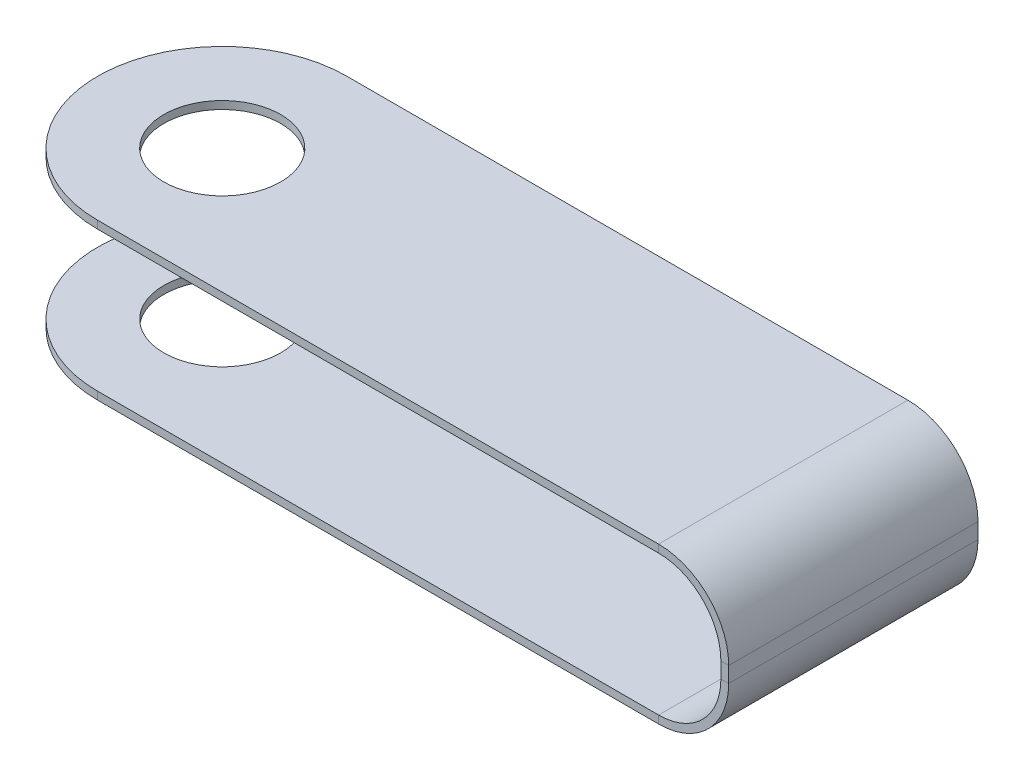
from build123d import *

# Parameters (mm, degrees)
BASE_FLANGE1_DEPTH  = 16
CUT_EXTRUDE1_DEPTH  = 53.04084934
SKETCH7_R           = 3.75
BOSS_EXTRUDE1_DEPTH = 2
CUT_EXTRUDE2_START  = -2
SKETCH8_R           = 3.75
CUT_EXTRUDE2_DEPTH  = 2
BOSS_EXTRUDE2_START = -2
SKETCH9_R           = 3.75
BOSS_EXTRUDE2_DEPTH = 2
CUT_EXTRUDE4_START  = -2
SKETCH10_R          = 3.75
CUT_EXTRUDE4_DEPTH  = 2


# Sheet-metal steps are written as plain solids
with BuildPart() as part:
    # Sketch1 → Base-Flange1 (new body)
    with BuildSketch(Plane.XY):
        with BuildLine():
            Line((0, 0), (44, 0))
            ThreePointArc((44, 0), (46.828427125, 1.171572875), (48, 4))
            Line((48, 4), (48, 5))
            ThreePointArc((48, 5), (46.828427125, 7.828427125), (44, 9))
            Line((44, 9), (0, 9))
            Line((0, 9), (0, 9.5))
            Line((0, 9.5), (44, 9.5))
            ThreePointArc((44, 9.5), (47.181980515, 8.181980515), (48.5, 5))
            Line((48.5, 5), (48.5, 4))
            ThreePointArc((48.5, 4), (47.181980515, 0.818019485), (44, -0.5))
            Line((44, -0.5), (0, -0.5))
            Line((0, -0.5), (0, 0))
        make_face()
    extrude(amount=BASE_FLANGE1_DEPTH)

    # Sketch6 → Cut-Extrude1 (cut, through all)
    with BuildSketch(Plane.XZ.offset(0.5)):
        with BuildLine():
            Line((8, 0), (8, -3.97427409))
            Line((8, -3.97427409), (-3.94829055, -3.97427409))
            Line((-3.94829055, -3.97427409), (-3.94829055, 19.074328647))
            Line((-3.94829055, 19.074328647), (8, 19.074328647))
            Line((8, 19.074328647), (8, 16))
            ThreePointArc((8, 16), (0, 8), (8, 0))
        make_face()
    extrude(amount=-CUT_EXTRUDE1_DEPTH, mode=Mode.SUBTRACT)

    # Sketch7 → Boss-Extrude1 (add)
    with BuildSketch(Plane(origin=(0, 9.5, 0), x_dir=(1, 0, 0), z_dir=(0, 1, 0))):
        with Locations(Location((8, -8, 0), (0, 0, 180))):
            Circle(SKETCH7_R)
    extrude(amount=-BOSS_EXTRUDE1_DEPTH)

    # Sketch8 → Cut-Extrude2 (cut)
    with BuildSketch(Plane.XZ.offset(-7.5).offset(CUT_EXTRUDE2_START)):
        with Locations((8, 8)):
            Circle(SKETCH8_R)
    extrude(amount=CUT_EXTRUDE2_DEPTH, mode=Mode.SUBTRACT)

    # Sketch9 → Boss-Extrude2 (add)
    with BuildSketch(Plane.XZ.offset(0.5).offset(BOSS_EXTRUDE2_START)):
        with Locations((8, 8)):
            Circle(SKETCH9_R)
    extrude(amount=BOSS_EXTRUDE2_DEPTH)

    # Sketch10 → Cut-Extrude4 (cut)
    with BuildSketch(Plane.XZ.offset(0.5).offset(CUT_EXTRUDE4_START)):
        with Locations((8, 8)):
            Circle(SKETCH10_R)
    extrude(amount=CUT_EXTRUDE4_DEPTH, mode=Mode.SUBTRACT)


solid = part.part
